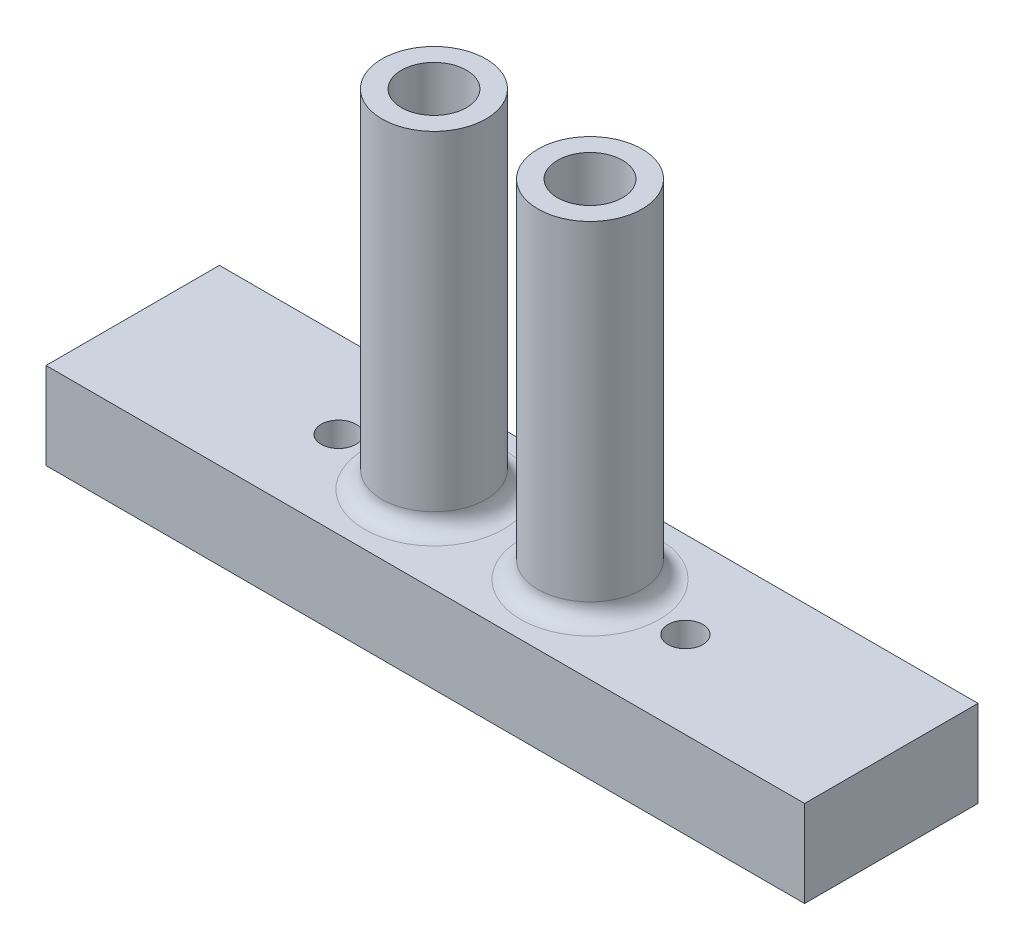
from build123d import *

# Parameters (mm, degrees)
SKETCH1_W           = 111.125
SKETCH1_H           = 25.4
BOSS_EXTRUDE1_DEPTH = 12.7
SKETCH2_R           = 7.62
SKETCH2_R_2         = 4.7625
BOSS_EXTRUDE2_DEPTH = 50.8
SKETCH2_9_R         = 2.5527
CUT_EXTRUDE1_DEPTH  = 125.798099445
FILLET1_R           = 2.54


with BuildPart() as part:
    # Sketch1 → Boss-Extrude1 (new body)
    with BuildSketch(Plane(origin=(0, 0, 0), x_dir=(1, 0, 0), z_dir=(0, 1, 0))):
        with Locations((-55.5625, -12.7)):
            Rectangle(SKETCH1_W, SKETCH1_H)
    extrude(amount=BOSS_EXTRUDE1_DEPTH)

    # Sketch2 → Boss-Extrude2 (add)
    # profile 1 of 2: a face of its own
    with BuildSketch(Plane(origin=(0, 12.7, 0), x_dir=(1, 0, 0), z_dir=(0, 1, 0))):
        with Locations((-44.1325, -12.7)):
            Circle(SKETCH2_R)
        with Locations((-44.1325, -12.7)):
            Circle(SKETCH2_R_2, mode=Mode.SUBTRACT)
    # profile 2 of 2: a face of its own
    with BuildSketch(Plane(origin=(0, 12.7, 0), x_dir=(1, 0, 0), z_dir=(0, 1, 0))):
        with Locations((-66.9925, -12.7)):
            Circle(SKETCH2_R)
        with Locations((-66.9925, -12.7)):
            Circle(SKETCH2_R_2, mode=Mode.SUBTRACT)
    extrude(amount=BOSS_EXTRUDE2_DEPTH)

    # Sketch2<9> → Cut-Extrude1 (cut, through all)
    with BuildSketch(Plane(origin=(0, 12.7, 0), x_dir=(1, 0, 0), z_dir=(0, 1, 0))):
        with Locations((-30.1625, -12.7)):
            Circle(SKETCH2_9_R)
        with Locations((-80.9625, -12.7)):
            Circle(SKETCH2_9_R)
    extrude(amount=-CUT_EXTRUDE1_DEPTH, mode=Mode.SUBTRACT)

    # Fillet1
    fillet1_edges = [part.edges().sort_by_distance(p)[0] for p in [
        (-51.7525, 12.7, 12.7),
        (-74.6125, 12.7, 12.7),
    ]]
    fillet(fillet1_edges, radius=FILLET1_R)


solid = part.part
